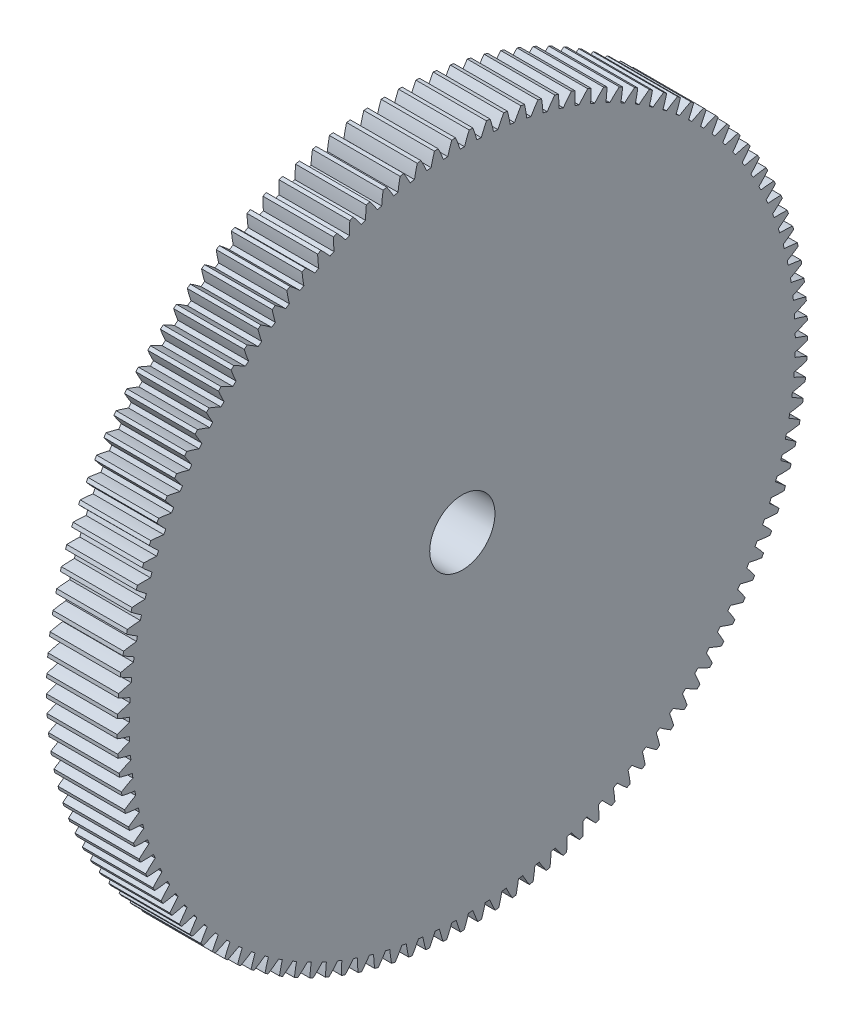
from build123d import *

# Parameters (mm, degrees)
BASPROSKE_W     = 41.275
BASPROSKE_H     = 201.6125
TOOTHCUT_DEPTH  = 289.095168195
TEETHCUTS_COUNT = 125
TEETHCUTS_ANGLE = 357.12
BORSKE_R        = 19.05
BORE_DEPTH      = 50.8001016


with BuildPart() as part:
    # BasProSke → Base-Revolve (revolve)
    with BuildSketch(Plane(origin=(0, 0, 0), x_dir=(1, 0, 0), z_dir=(0, 1, 0))):
        with Locations((20.6375, 100.80625)):
            Rectangle(BASPROSKE_W, BASPROSKE_H)
    revolve(axis=Axis((-10, 0, 0), (1, 0, 0)))

    # TooCutSke → ToothCut (cut, through all)
    with BuildSketch(Plane(origin=(0, 0, 0), x_dir=(0, 0, -1), z_dir=(1, 0, 0))):
        with BuildLine():
            ThreePointArc((1.291206596, 194.463193338), (0, 194.46748), (-1.291206596, 194.463193338))
            ThreePointArc((-1.291206596, 194.463193338), (-2.557695519, 198.063267352), (-3.995762113, 201.598305056))
            ThreePointArc((-3.995762113, 201.598305056), (0, 201.6379), (3.995762113, 201.598305056))
            ThreePointArc((3.995762113, 201.598305056), (2.557695519, 198.063267352), (1.291206596, 194.463193338))
        make_face()
    toothcut = extrude(amount=TOOTHCUT_DEPTH, mode=Mode.SUBTRACT)

    # TeethCuts: ToothCut ×125 about axis
    teethcuts_axis = Axis((-10, 0, 0), (1, 0, 0))
    for i in range(1, TEETHCUTS_COUNT):
        add(toothcut.rotate(teethcuts_axis, i * TEETHCUTS_ANGLE / (TEETHCUTS_COUNT - 1)), mode=Mode.SUBTRACT)

    # BorSke → Bore (cut, symmetric)
    with BuildSketch(Plane(origin=(0, 0, 0), x_dir=(0, 0, -1), z_dir=(1, 0, 0))):
        Circle(BORSKE_R)
    extrude(amount=BORE_DEPTH, both=True, mode=Mode.SUBTRACT)


solid = part.part
